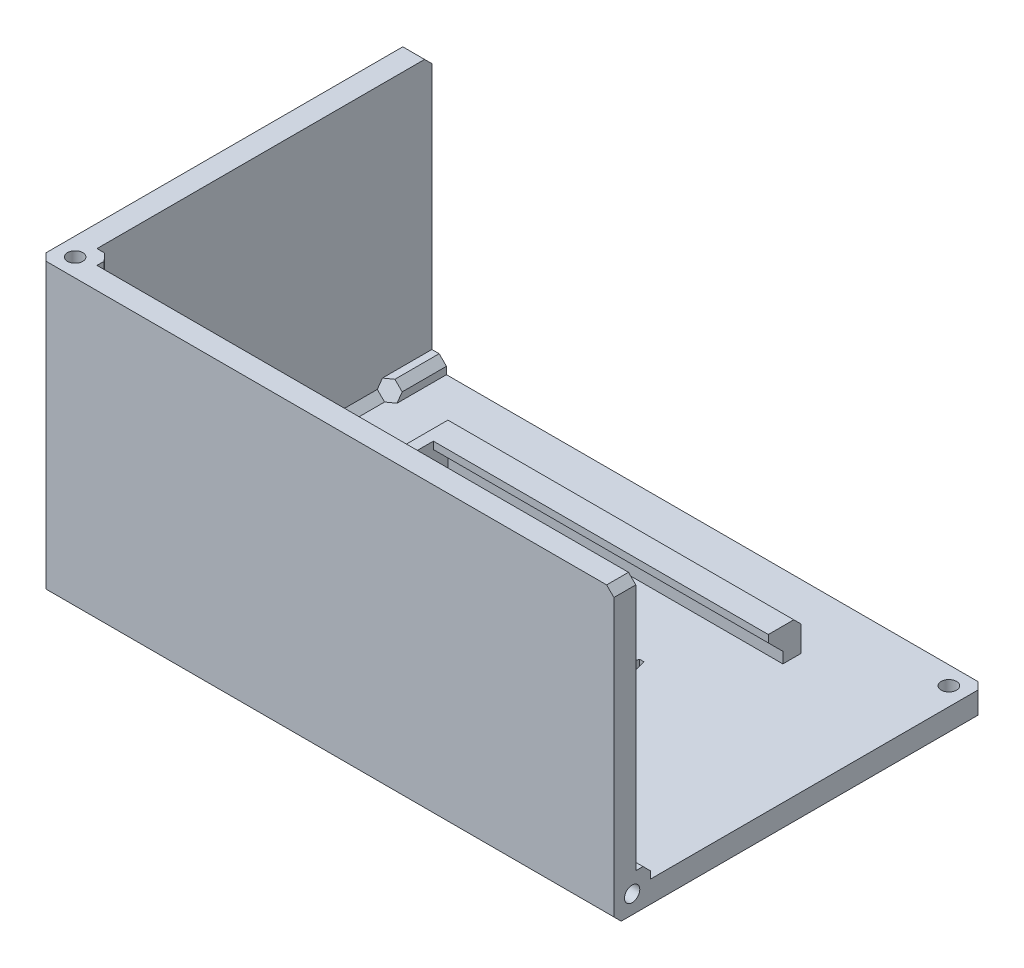
from build123d import *

# Parameters (mm, degrees)
SKETCH_1_W          = 79
SKETCH_1_H          = 51
EXTRUDE_1_DEPTH     = 3
EXTRUDE_2_DEPTH     = 37
SKETCH_3_W          = 5
SKETCH_3_H          = 5
EXTRUDE_3_DEPTH     = 6
SKETCH_4_R          = 1.05
CUT_EXTRUDE_1_DEPTH = 5
SKETCH_5_R          = 1.05
CUT_EXTRUDE_2_DEPTH = 5
SKETCH_6_W          = 5
SKETCH_6_H          = 5
EXTRUDE_4_DEPTH     = 6
SKETCH_7_R          = 1.05
CUT_EXTRUDE_3_DEPTH = 5
SKETCH_8_W          = 5
SKETCH_8_H          = 5
EXTRUDE_5_DEPTH     = 6
SKETCH_9_R          = 1.05
CUT_EXTRUDE_4_DEPTH = 5
CHAMFER_1_SIZE      = 1
CHAMFER_2_SIZE      = 1.5
CUT_EXTRUDE_START   = -3
CUT_EXTRUDE_5_DEPTH = 3
EXTRUDE_6_DEPTH     = 23
EXTRUDE_6_2_DEPTH   = 23
CHAMFER_3_SIZE      = 1
CHAMFER_4_SIZE      = 1
EXTRUDE_7_DEPTH     = 1.5


# Read off the part's stored shape, not the designer's step: 切除-拉伸5
with BuildPart() as part:
    # 草图1 → 凸台-拉伸1 (new body)
    with BuildSketch(Plane(origin=(0, 0, 0), x_dir=(1, 0, 0), z_dir=(0, 1, 0))):
        Rectangle(SKETCH_1_W, SKETCH_1_H)
    extrude(amount=EXTRUDE_1_DEPTH)

    # 草图2 → 凸台-拉伸2 (add)
    with BuildSketch(Plane(origin=(0, 3, 0), x_dir=(1, 0, 0), z_dir=(0, 1, 0))):
        Polygon((-39.5, 25.5), (-39.5, -25.5), (39.5, -25.5), (39.5, -22.5), (-36.5, -22.5), (-36.5, 25.5), align=None)
    extrude(amount=EXTRUDE_2_DEPTH)

    # 草图3 → 凸台-拉伸3 (add)
    with BuildSketch(Plane(origin=(39.5, 0, 0), x_dir=(0, 0, -1), z_dir=(1, 0, 0))):
        with Locations((-23, 2.5)):
            Rectangle(SKETCH_3_W, SKETCH_3_H)
    extrude(amount=-EXTRUDE_3_DEPTH)

    # 草图4 → 切除-拉伸1 (cut)
    with BuildSketch(Plane(origin=(39.5, 0, 0), x_dir=(0, 0, -1), z_dir=(1, 0, 0))):
        with Locations((-23, 2.5)):
            Circle(SKETCH_4_R)
    extrude(amount=-CUT_EXTRUDE_1_DEPTH, mode=Mode.SUBTRACT)

    # 草图5 → 切除-拉伸2 (cut)
    with BuildSketch(Plane(origin=(0, 0, 0), x_dir=(-1, 0, 0), z_dir=(0, -1, 0))):
        with Locations(Location((-37, 23, 0), (0, 0, 90))):
            Circle(SKETCH_5_R)
    extrude(amount=-CUT_EXTRUDE_2_DEPTH, mode=Mode.SUBTRACT)

    # 草图6 → 凸台-拉伸4 (add)
    with BuildSketch(Plane(origin=(0, 0, -25.5), x_dir=(-1, 0, 0), z_dir=(0, 0, -1))):
        with Locations((37, 2.5)):
            Rectangle(SKETCH_6_W, SKETCH_6_H)
    extrude(amount=-EXTRUDE_4_DEPTH)

    # 草图7 → 切除-拉伸3 (cut)
    with BuildSketch(Plane(origin=(0, 0, -25.5), x_dir=(-1, 0, 0), z_dir=(0, 0, -1))):
        with Locations((37, 2.5)):
            Circle(SKETCH_7_R)
    extrude(amount=-CUT_EXTRUDE_3_DEPTH, mode=Mode.SUBTRACT)

    # 草图8 → 凸台-拉伸5 (add)
    with BuildSketch(Plane(origin=(0, 40, 0), x_dir=(1, 0, 0), z_dir=(0, 1, 0))):
        with Locations((-37, -23)):
            Rectangle(SKETCH_8_W, SKETCH_8_H)
    extrude(amount=-EXTRUDE_5_DEPTH)

    # 草图9 → 切除-拉伸4 (cut)
    with BuildSketch(Plane(origin=(0, 40, 0), x_dir=(1, 0, 0), z_dir=(0, 1, 0))):
        with Locations(Location((-37, -23, 0), (0, 0, 270))):
            Circle(SKETCH_9_R)
    extrude(amount=-CUT_EXTRUDE_4_DEPTH, mode=Mode.SUBTRACT)

    # 倒角1
    chamfer_1_edges = [part.edges().sort_by_distance(p)[0] for p in [
        (-34.5, 37, 20.5),
        (-36.5, 3, 1.5),
        (-38, 40, -25.5),
        (39.5, 40, 24),
        (-1.5, 3, 22.5),
        (36.5, 5, 20.5),
        (0, 0, 25.5),
        (-39.5, 0, 0),
        (-34.5, 5, -22.5),
        (-39.5, 20, 25.5),
        (39.5, 1.5, -25.5),
        (-36.5, 18.5, 22.5),
    ]]
    chamfer(chamfer_1_edges, length=CHAMFER_1_SIZE)

    # 倒角2
    # the kernel refuses this chamfer: 1.5 mm, written as the material it adds along each edge
    with BuildSketch(Plane(origin=(-39.22768172, 6.72768172, -19.5), x_dir=(0.7068394360706735, 0.7068394360706735, -0.027495876610586743), z_dir=(0.7071067811865476, -0.7071067811865476, 0))) as chamfer_2_piece_1_section:
        Polygon((CHAMFER_2_SIZE * 0.999621916911, CHAMFER_2_SIZE * 0.0274958766106), (-CHAMFER_2_SIZE * 0.0274958766106, CHAMFER_2_SIZE * 0.999621916911), (0, 0), align=None)
    chamfer_2_piece_1 = extrude(amount=9.129262526, mode=Mode.PRIVATE)
    chamfer_2_piece_1 = split(chamfer_2_piece_1, bisect_by=Plane(origin=(-35.623861918, 5, -19.015969788), z_dir=(0, -1, 0)), keep=Keep.TOP, mode=Mode.PRIVATE)
    chamfer_2_piece_1 = split(chamfer_2_piece_1, bisect_by=Plane(origin=(-34.5, 3.876138082, -19.015969788), z_dir=(-1, 0, 0)), keep=Keep.TOP, mode=Mode.PRIVATE)
    chamfer_2_piece_1 = split(chamfer_2_piece_1, bisect_by=Plane(origin=(-35, 4.5, -19.015969788), z_dir=(-0.7071067811865476, -0.7071067811865476, 0)), keep=Keep.TOP, mode=Mode.PRIVATE)
    add(chamfer_2_piece_1)
    with BuildSketch(Plane(origin=(-32.77231828, 34, 25.22768172), x_dir=(-0.019442520806014937, -0.9996219169112968, 0.019442520806014937), z_dir=(-0.7071067811865476, 0, -0.7071067811865476))) as chamfer_2_piece_2_section:
        Polygon((CHAMFER_2_SIZE * 0.999621916911, -CHAMFER_2_SIZE * 0.0274958766106), (-CHAMFER_2_SIZE * 0.0274958766106, -CHAMFER_2_SIZE * 0.999621916911), (0, 0), align=None)
    chamfer_2_piece_2 = extrude(amount=9.129262526, mode=Mode.PRIVATE)
    chamfer_2_piece_2 = split(chamfer_2_piece_2, bisect_by=Plane(origin=(-34.5, 33.515969788, 21.623861918), z_dir=(-1, 0, 0)), keep=Keep.TOP, mode=Mode.PRIVATE)
    chamfer_2_piece_2 = split(chamfer_2_piece_2, bisect_by=Plane(origin=(-35, 33.515969788, 21), z_dir=(-0.7071067811865476, 0, 0.7071067811865476)), keep=Keep.TOP, mode=Mode.PRIVATE)
    chamfer_2_piece_2 = split(chamfer_2_piece_2, bisect_by=Plane(origin=(-35.623861918, 33.515969788, 20.5), z_dir=(0, 0, 1)), keep=Keep.TOP, mode=Mode.PRIVATE)
    add(chamfer_2_piece_2)
    with BuildSketch(Plane(origin=(33.5, 6.72768172, 25.22768172), x_dir=(0.027495876610586733, 0.7068394360706735, -0.7068394360706735), z_dir=(0, -0.7071067811865476, -0.7071067811865476))) as chamfer_2_piece_3_section:
        Polygon((CHAMFER_2_SIZE * 0.999621916911, -CHAMFER_2_SIZE * 0.0274958766106), (-CHAMFER_2_SIZE * 0.0274958766106, -CHAMFER_2_SIZE * 0.999621916911), (0, 0), align=None)
    chamfer_2_piece_3 = extrude(amount=9.129262526, mode=Mode.PRIVATE)
    chamfer_2_piece_3 = split(chamfer_2_piece_3, bisect_by=Plane(origin=(33.015969788, 5, 21.623861918), z_dir=(0, -1, 0)), keep=Keep.TOP, mode=Mode.PRIVATE)
    chamfer_2_piece_3 = split(chamfer_2_piece_3, bisect_by=Plane(origin=(33.015969788, 4.5, 21), z_dir=(0, -0.7071067811865476, 0.7071067811865476)), keep=Keep.TOP, mode=Mode.PRIVATE)
    chamfer_2_piece_3 = split(chamfer_2_piece_3, bisect_by=Plane(origin=(33.015969788, 3.876138082, 20.5), z_dir=(0, 0, 1)), keep=Keep.TOP, mode=Mode.PRIVATE)
    add(chamfer_2_piece_3)

    # 切除-拉伸5 outline → 切除-拉伸5 (cut)
    # profile 1 of 6: a face of its own
    with BuildSketch(Plane.XZ.offset(CUT_EXTRUDE_START)):
        with BuildLine():
            add(Edge.make_bspline(
                [(-15.48263371, -3.754815354), (-15.420128546, -3.756270608), (-15.309331072, -3.75885021), (-15.198540428, -3.761102728), (-15.150223737, -3.761203962)],
                knots=[0, 0, 0, 0, 0.37922531, 0.672219763, 0.672219763, 0.672219763, 0.672219763], degree=3))
            Line((-15.48263371, -3.754815354), (-16.788834434, -3.767600353))
            Line((-16.788834434, -3.767600353), (-17.153206904, -3.767600353))
            add(Edge.make_bspline(
                [(-17.470701044, -4.193766984), (-17.4945366, -4.167140367), (-17.536939279, -4.119772479), (-17.587669994, -4.053045156), (-17.622961086, -4.005137812), (-17.648748807, -3.957671202), (-17.627972402, -3.892415705), (-17.574871211, -3.841403188), (-17.501024479, -3.802184195), (-17.410113769, -3.780480784), (-17.291293362, -3.769689206), (-17.202245088, -3.76834216), (-17.153206904, -3.767600353)],
                knots=[0, 0, 0, 0, 0.124364607, 0.221240593, 0.290473734, 0.333628536, 0.401974035, 0.506869473, 0.585361363, 0.690256801, 0.829426855, 1, 1, 1, 1], degree=3))
            Line((-17.470701044, -4.193766984), (-16.882591093, -4.745652771))
            Line((-16.882591093, -4.745652771), (-16.339228638, -4.617802782))
            add(Edge.make_bspline(
                [(-15.11826124, -4.489952793), (-15.179395347, -4.492889571), (-15.321878045, -4.499734197), (-15.552292145, -4.527157062), (-15.807563179, -4.557246182), (-16.019075926, -4.574620737), (-16.17093028, -4.57831416), (-16.251903171, -4.592328053), (-16.309223401, -4.595941015), (-16.331642717, -4.612275692), (-16.339228638, -4.617802782)],
                knots=[0, 0, 0, 0, 0.14908402, 0.347463872, 0.565143028, 0.775125617, 0.865267116, 0.933313433, 0.977435571, 1, 1, 1, 1], degree=3))
            Line((-15.11826124, -4.489952793), (-14.383123801, -4.477167794))
            Line((-14.383123801, -4.477167794), (-13.481781377, -4.447336129))
            Line((-13.481781377, -4.447336129), (-13.117408907, -4.447336129))
            add(Edge.make_bspline(
                [(-12.844662263, -4.434551131), (-12.856733865, -4.435326958), (-12.88795805, -4.437333701), (-12.945563942, -4.438606114), (-13.024323046, -4.443900637), (-13.084016918, -4.446103741), (-13.117408907, -4.447336129)],
                knots=[0, 0, 0, 0, 0.132892113, 0.343736303, 0.63289448, 1, 1, 1, 1], degree=3))
            Line((-12.844662263, -4.434551131), (-12.48455146, -4.462251962))
            Line((-12.48455146, -4.462251962), (-12.152141487, -4.462251962))
            add(Edge.make_bspline(
                [(-11.943319838, -4.033954497), (-11.920286338, -4.054869257), (-11.878627775, -4.09269585), (-11.825351543, -4.150132093), (-11.797667666, -4.208577456), (-11.782095986, -4.276624466), (-11.798051338, -4.354827039), (-11.845364915, -4.418751501), (-11.906256775, -4.448977916), (-11.971642101, -4.462934812), (-12.055528497, -4.468633332), (-12.118062222, -4.464502926), (-12.152141487, -4.462251962)],
                knots=[0, 0, 0, 0, 0.122226479, 0.221059731, 0.304562511, 0.372874983, 0.492013136, 0.605167966, 0.671226803, 0.754356801, 0.8661308, 1, 1, 1, 1], degree=3))
            Line((-11.943319838, -4.033954497), (-12.584700618, -3.599264533))
            Line((-12.584700618, -3.599264533), (-12.995951417, -3.641881197))
            add(Edge.make_bspline(
                [(-14.253142979, -3.72498369), (-14.241069262, -3.724254777), (-14.200600395, -3.721811594), (-14.133804667, -3.718818201), (-14.035759628, -3.713546988), (-13.906496312, -3.704823325), (-13.727589359, -3.691553447), (-13.517302044, -3.678037381), (-13.313307866, -3.665774907), (-13.152307593, -3.651228234), (-13.053494324, -3.645257105), (-13.00802618, -3.642589595), (-12.995951417, -3.641881197)],
                knots=[0, 0, 0, 0, 0.028799673, 0.096531182, 0.159196007, 0.262579241, 0.404999879, 0.586342428, 0.764309979, 0.891553343, 0.971200327, 1, 1, 1, 1], degree=3))
            Line((-14.253142979, -3.72498369), (-14.253142979, 1.95368667))
            add(Edge.make_bspline(
                [(-14.12529299, 4.001417333), (-14.103307291, 3.949817758), (-14.064231049, 3.858107341), (-14.021296363, 3.734410267), (-13.995680596, 3.642650534), (-13.994293618, 3.558975286), (-14.026344726, 3.475775687), (-14.070473147, 3.380329601), (-14.116807093, 3.278603757), (-14.149093517, 3.169655273), (-14.169077049, 3.052077149), (-14.190383388, 2.915189154), (-14.205026758, 2.739107816), (-14.230753656, 2.516667548), (-14.250183009, 2.248052943), (-14.252121284, 2.055293279), (-14.253142979, 1.95368667)],
                knots=[0, 0, 0, 0, 0.079940062, 0.142081331, 0.186797154, 0.215157619, 0.259689521, 0.311830388, 0.365827104, 0.418700666, 0.473330159, 0.535784319, 0.616210576, 0.725159261, 0.855127185, 1, 1, 1, 1], degree=3))
            Line((-14.12529299, 4.001417333), (-14.327722139, 4.493639792))
            add(Edge.make_bspline(
                [(-14.623907948, 4.913413924), (-14.614532244, 4.91407852), (-14.584834338, 4.916183655), (-14.532334699, 4.87921806), (-14.460874643, 4.817129148), (-14.410955398, 4.705579953), (-14.359148195, 4.597706415), (-14.337029803, 4.524461895), (-14.327722139, 4.493639792)],
                knots=[0, 0, 0, 0, 0.051125076, 0.161940666, 0.334442272, 0.577379905, 0.822156799, 1, 1, 1, 1], degree=3))
            add(Edge.make_bspline(
                [(-15.060728745, 4.329565639), (-15.056800455, 4.40041657), (-15.048827177, 4.544223216), (-14.989949296, 4.715359407), (-14.91926111, 4.838465341), (-14.836660727, 4.900658324), (-14.73373167, 4.926930069), (-14.662292735, 4.918137988), (-14.623907948, 4.913413924)],
                knots=[0, 0, 0, 0, 0.250292928, 0.508021362, 0.633615737, 0.746809256, 0.863958321, 1, 1, 1, 1], degree=3))
            Line((-15.060728745, 4.329565639), (-15.150223737, 2.867814094))
            Line((-15.150223737, 2.867814094), (-15.150223737, -3.761203962))
        make_face()
    # profile 2 of 6: a face of its own
    with BuildSketch(Plane.XZ.offset(CUT_EXTRUDE_START)):
        with BuildLine():
            add(Edge.make_bspline(
                [(-8.103558491, 4.67476061), (-8.041461338, 4.669505959), (-7.911944528, 4.658546267), (-7.715013609, 4.60352904), (-7.507884986, 4.523610081), (-7.29029666, 4.418723222), (-7.072587453, 4.276791169), (-6.865733405, 4.089483475), (-6.672111059, 3.858998023), (-6.492777988, 3.58997156), (-6.32535958, 3.293622735), (-6.17766402, 2.97564047), (-6.044194131, 2.641630978), (-5.931969757, 2.294394866), (-5.836545261, 1.944521123), (-5.76254477, 1.60077644), (-5.70482392, 1.268387486), (-5.674613858, 0.946281813), (-5.659006507, 0.638408038), (-5.64845873, 0.34497151), (-5.653353031, 0.067012403), (-5.66323041, -0.113246613), (-5.668016194, -0.20058565)],
                knots=[0, 0, 0, 0, 0.031334491, 0.06535474, 0.102501622, 0.143147401, 0.186813498, 0.232930836, 0.28319018, 0.338070684, 0.395589235, 0.45449339, 0.514558707, 0.576678801, 0.638219114, 0.697172153, 0.753760562, 0.808055898, 0.860017348, 0.909058299, 0.955936957, 1, 1, 1, 1], degree=3))
            add(Edge.make_bspline(
                [(-11.110164074, 0.127562656), (-11.105887809, 0.213551505), (-11.097002003, 0.392230866), (-11.0691956, 0.668928746), (-11.024222694, 0.964005463), (-10.955894021, 1.386292929), (-10.824019358, 1.927410801), (-10.643014089, 2.462920573), (-10.465197802, 2.883443779), (-10.306054708, 3.186664878), (-10.128709571, 3.476969506), (-9.936077692, 3.752192597), (-9.725737528, 4.000631158), (-9.50017715, 4.212336923), (-9.258779885, 4.378323317), (-9.009841578, 4.50106052), (-8.762973023, 4.586491697), (-8.530194119, 4.647052706), (-8.311212831, 4.680849105), (-8.171125208, 4.676741689), (-8.103558491, 4.67476061)],
                knots=[0, 0, 0, 0, 0.043083178, 0.089524105, 0.139090764, 0.192444863, 0.303578138, 0.417336933, 0.47498038, 0.531899195, 0.588534262, 0.645145899, 0.699856338, 0.751171499, 0.799484671, 0.845903826, 0.889637579, 0.929985596, 0.966230826, 1, 1, 1, 1], degree=3))
            add(Edge.make_bspline(
                [(-8.546771788, -4.75843777), (-8.618174598, -4.749705375), (-8.76513644, -4.731732288), (-8.985867543, -4.665920384), (-9.214415884, -4.576432305), (-9.447401426, -4.45860015), (-9.673899032, -4.308644958), (-9.885782929, -4.126375434), (-10.072638656, -3.907720204), (-10.242086326, -3.663572474), (-10.389917627, -3.398755041), (-10.523926998, -3.124830645), (-10.64672324, -2.846372626), (-10.75064422, -2.558217375), (-10.843958112, -2.25996486), (-10.920358026, -1.94684998), (-10.992403973, -1.620550753), (-11.048792305, -1.281312832), (-11.092669241, -0.93382811), (-11.114027305, -0.581614003), (-11.125176521, -0.227519979), (-11.115178494, 0.008958844), (-11.110164074, 0.127562656)],
                knots=[0, 0, 0, 0, 0.035728167, 0.073536002, 0.114150379, 0.157763238, 0.203135392, 0.248971552, 0.296303111, 0.345800684, 0.396594084, 0.447001367, 0.497479185, 0.547891422, 0.599300463, 0.652859799, 0.708162251, 0.76549414, 0.823869367, 0.882298034, 0.940967645, 1, 1, 1, 1], degree=3))
            add(Edge.make_bspline(
                [(-5.668016194, -0.20058565), (-5.679560027, -0.339220651), (-5.703358919, -0.625032078), (-5.764412461, -1.062838839), (-5.846102501, -1.522705486), (-5.946732252, -1.995420454), (-6.074869473, -2.463631755), (-6.249696975, -2.903620786), (-6.458886584, -3.31167186), (-6.709643311, -3.673339634), (-6.969109927, -3.988791014), (-7.223650903, -4.247919848), (-7.466475297, -4.448980292), (-7.706720437, -4.581236117), (-7.934068957, -4.665715486), (-8.147198996, -4.724574345), (-8.350252477, -4.759694644), (-8.48272495, -4.758847393), (-8.546771788, -4.75843777)],
                knots=[0, 0, 0, 0, 0.070798454, 0.145958862, 0.224892982, 0.308497601, 0.391926937, 0.471616661, 0.549073153, 0.624781961, 0.695142443, 0.756752631, 0.809487994, 0.854962053, 0.89558416, 0.932683052, 0.967454086, 1, 1, 1, 1], degree=3))
        make_face()
        with BuildLine():
            add(Edge.make_bspline(
                [(-6.575751119, -0.153707321), (-6.570868248, -0.084129651), (-6.56061339, 0.061995266), (-6.557413696, 0.292367535), (-6.562110677, 0.544605463), (-6.574010519, 0.816928046), (-6.599339755, 1.104261466), (-6.639404865, 1.400280603), (-6.697490454, 1.701776081), (-6.771801412, 2.00437608), (-6.856566369, 2.301779416), (-6.957543049, 2.583015202), (-7.066656689, 2.846131926), (-7.190322027, 3.084008664), (-7.314641758, 3.296140681), (-7.44440261, 3.472729502), (-7.575915592, 3.611928276), (-7.710675613, 3.71154057), (-7.83861863, 3.78000299), (-7.952964516, 3.832257625), (-8.05441565, 3.869971995), (-8.120360367, 3.876831376), (-8.150436821, 3.879959843)],
                knots=[0, 0, 0, 0, 0.045157309, 0.094838015, 0.149117275, 0.208512086, 0.271305268, 0.335829695, 0.401857755, 0.47001556, 0.537551362, 0.601995419, 0.663414278, 0.721832335, 0.775468658, 0.822473626, 0.863456253, 0.898963146, 0.930457279, 0.957216217, 0.980486921, 1, 1, 1, 1], degree=3))
            add(Edge.make_bspline(
                [(-8.493500959, -3.965767836), (-8.462852593, -3.963721732), (-8.396564001, -3.959296263), (-8.292282963, -3.934217552), (-8.176763764, -3.894309241), (-8.043497878, -3.842175263), (-7.894819769, -3.747781676), (-7.737286451, -3.595607608), (-7.561424269, -3.391268583), (-7.369813483, -3.137889464), (-7.181593529, -2.836168254), (-7.020119374, -2.488372322), (-6.888384518, -2.102335416), (-6.789821214, -1.687987037), (-6.709913118, -1.270700612), (-6.645368237, -0.872125774), (-6.598788147, -0.503304874), (-6.583199408, -0.266738549), (-6.575751119, -0.153707321)],
                knots=[0, 0, 0, 0, 0.02013971, 0.043559681, 0.0701049, 0.100417777, 0.137294984, 0.184821717, 0.243652345, 0.314258093, 0.393203917, 0.476653558, 0.565436976, 0.660560202, 0.756045125, 0.844368049, 0.92563916, 1, 1, 1, 1], degree=3))
            add(Edge.make_bspline(
                [(-10.151289154, -1.161591403), (-10.137446538, -1.260504857), (-10.110356175, -1.454081082), (-10.052858954, -1.733319246), (-9.995530836, -1.997383456), (-9.901227137, -2.322134532), (-9.758879337, -2.708854892), (-9.58914083, -3.076617203), (-9.432469493, -3.346373336), (-9.303087167, -3.517505655), (-9.165620845, -3.658880678), (-9.019672457, -3.769381021), (-8.872690999, -3.84625546), (-8.738623408, -3.911489933), (-8.612751004, -3.951250591), (-8.531348196, -3.961160394), (-8.493500959, -3.965767836)],
                knots=[0, 0, 0, 0, 0.086217949, 0.168730788, 0.246098236, 0.319475708, 0.460533721, 0.601553063, 0.668659718, 0.729501491, 0.786314944, 0.838446558, 0.886758348, 0.929294165, 0.967126189, 1, 1, 1, 1], degree=3))
            add(Edge.make_bspline(
                [(-8.150436821, 3.879959843), (-8.190974644, 3.882991205), (-8.275337721, 3.889299758), (-8.405899898, 3.866490177), (-8.543853677, 3.82777926), (-8.689096496, 3.768438607), (-8.840668057, 3.679616503), (-8.988141793, 3.547889195), (-9.140381729, 3.383044639), (-9.287047616, 3.182444188), (-9.430160603, 2.959734277), (-9.562149216, 2.720376636), (-9.682201433, 2.468949211), (-9.820031781, 2.115070434), (-9.963925994, 1.654564271), (-10.088611958, 1.093018842), (-10.168879324, 0.544943569), (-10.210394331, 0.102742292), (-10.220237451, -0.247501619), (-10.209728527, -0.529713197), (-10.189552513, -0.837631843), (-10.164365228, -1.050881858), (-10.151289154, -1.161591403)],
                knots=[0, 0, 0, 0, 0.020541034, 0.042747852, 0.06669156, 0.093176477, 0.122082653, 0.155286602, 0.193007636, 0.235721178, 0.281076877, 0.32718137, 0.374221639, 0.422240241, 0.519629983, 0.618538811, 0.713580882, 0.800346511, 0.843577702, 0.89113898, 0.943484393, 1, 1, 1, 1], degree=3))
        make_face(mode=Mode.SUBTRACT)
    # profile 3 of 6: a face of its own
    with BuildSketch(Plane.XZ.offset(CUT_EXTRUDE_START)):
        with BuildLine():
            add(Edge.make_bspline(
                [(-0.07457916, -3.55664787), (-0.046774635, -3.574956566), (0.012475036, -3.61397123), (0.088850965, -3.668343226), (0.157053488, -3.723310378), (0.220052109, -3.776795222), (0.289096686, -3.845710218), (0.36451225, -3.92117868), (0.431575547, -3.999663209), (0.483266394, -4.073239645), (0.5025895, -4.145360801), (0.492991069, -4.225608075), (0.449218779, -4.304269687), (0.376018527, -4.379177834), (0.262375331, -4.41055043), (0.157028858, -4.391271137), (0.069066499, -4.36932015), (0.012090338, -4.357029405), (-0.029649386, -4.347691943), (-0.063764025, -4.34211412), (-0.105811882, -4.340122473), (-0.171224423, -4.340354055), (-0.267734135, -4.346223945), (-0.385729427, -4.348699538), (-0.505125445, -4.354677467), (-0.60612064, -4.362351661), (-0.680235686, -4.372266522), (-0.719554658, -4.381773994), (-0.735137439, -4.385541968)],
                knots=[0, 0, 0, 0, 0.044876518, 0.095629001, 0.126281512, 0.16293971, 0.206949964, 0.257729532, 0.306642541, 0.346222483, 0.377802953, 0.404764246, 0.453149673, 0.49649887, 0.542534919, 0.605127288, 0.638568656, 0.665049685, 0.683639488, 0.69623243, 0.711581098, 0.740303806, 0.784386899, 0.84186422, 0.899381398, 0.945497025, 0.978399539, 1, 1, 1, 1], degree=3))
            Line((-0.07457916, -3.55664787), (-0.07457916, 3.694577359))
            Line((-0.07457916, 3.694577359), (0.294054975, 3.694577359))
            add(Edge.make_bspline(
                [(-0.385680801, 4.683283943), (-0.354662421, 4.687022081), (-0.291635465, 4.694617689), (-0.216348414, 4.655201561), (-0.15066928, 4.617049262), (-0.086972715, 4.575440549), (-0.008363956, 4.52729086), (0.110674812, 4.453052161), (0.255486027, 4.354307349), (0.393671057, 4.219252917), (0.493387636, 4.092868765), (0.543574747, 3.97299097), (0.548182768, 3.872831531), (0.539330615, 3.798094695), (0.501904146, 3.750704245), (0.45001219, 3.726906894), (0.379897062, 3.705989198), (0.324806378, 3.698665447), (0.294054975, 3.694577359)],
                knots=[0, 0, 0, 0, 0.055199119, 0.112160353, 0.147818185, 0.193390787, 0.249301417, 0.314462416, 0.446940302, 0.564925092, 0.662206331, 0.736563346, 0.794442444, 0.843023772, 0.867676186, 0.899836932, 0.94408937, 1, 1, 1, 1], degree=3))
            add(Edge.make_bspline(
                [(-1.299808225, 4.461677295), (-1.245840585, 4.468195325), (-1.147173638, 4.480111989), (-1.013591208, 4.49452168), (-0.908588064, 4.506572507), (-0.805122364, 4.512167466), (-0.690333663, 4.537679589), (-0.568177468, 4.592998313), (-0.470343472, 4.652842726), (-0.407941619, 4.675279868), (-0.385680801, 4.683283943)],
                knots=[0, 0, 0, 0, 0.1713943, 0.313353561, 0.423660838, 0.504563725, 0.63986603, 0.791312573, 0.925554251, 1, 1, 1, 1], degree=3))
            Line((-1.299808225, 4.461677295), (-2.311953974, 4.348743138))
            add(Edge.make_bspline(
                [(-4.562113786, 1.862060845), (-4.558177522, 1.947371904), (-4.55051649, 2.113410187), (-4.521978558, 2.355977831), (-4.482525394, 2.586192919), (-4.427594326, 2.804686277), (-4.35524373, 3.009572609), (-4.26579924, 3.202105205), (-4.154127177, 3.378421083), (-4.025294772, 3.543111168), (-3.874750238, 3.692053319), (-3.705310698, 3.829811883), (-3.514994353, 3.952028874), (-3.307642718, 4.064113986), (-3.081614286, 4.158558728), (-2.839883221, 4.240460982), (-2.581593255, 4.303881983), (-2.403091993, 4.333580077), (-2.311953974, 4.348743138)],
                knots=[0, 0, 0, 0, 0.068690246, 0.133689707, 0.196353795, 0.256505239, 0.314703155, 0.370940653, 0.426910408, 0.482243505, 0.5388139, 0.59691354, 0.657618889, 0.720511849, 0.786317671, 0.854444639, 0.925683285, 1, 1, 1, 1], degree=3))
            add(Edge.make_bspline(
                [(-3.385893885, -0.432846464), (-3.445730996, -0.406102526), (-3.569692372, -0.350698525), (-3.71572979, -0.250983928), (-3.835160617, -0.149339308), (-3.931058591, -0.045838558), (-4.037107812, 0.075885409), (-4.145373061, 0.218789194), (-4.252610142, 0.374837313), (-4.339887665, 0.546738789), (-4.418682588, 0.723486891), (-4.478837527, 0.912858383), (-4.523727517, 1.118206224), (-4.553335517, 1.344837827), (-4.564660835, 1.59559137), (-4.562989612, 1.770432912), (-4.562113786, 1.862060845)],
                knots=[0, 0, 0, 0, 0.071557487, 0.148241856, 0.192299355, 0.242835515, 0.302309056, 0.368793424, 0.438799946, 0.508974282, 0.579238813, 0.650220785, 0.725783936, 0.808824048, 0.899811811, 1, 1, 1, 1], degree=3))
            Line((-3.385893885, -0.432846464), (-3.692733859, -0.643798946))
            add(Edge.make_bspline(
                [(-4.19987215, -2.263232145), (-4.191525425, -2.170088112), (-4.174265529, -1.977478871), (-4.129984766, -1.681588785), (-4.060937463, -1.372794241), (-3.976617217, -1.117007068), (-3.900850284, -0.922513146), (-3.838006131, -0.802176986), (-3.769995939, -0.709065092), (-3.717000059, -0.664297506), (-3.692733859, -0.643798946)],
                knots=[0, 0, 0, 0, 0.162140095, 0.335283754, 0.518441291, 0.710074423, 0.80178975, 0.880036575, 0.945070135, 1, 1, 1, 1], degree=3))
            add(Edge.make_bspline(
                [(-2.52503729, -4.703036108), (-2.60062967, -4.69729416), (-2.748315592, -4.686076033), (-2.961771335, -4.63436961), (-3.163285591, -4.563536753), (-3.348864302, -4.464346648), (-3.51642764, -4.346144468), (-3.662844286, -4.210322595), (-3.788201313, -4.06072601), (-3.88889441, -3.892910617), (-3.972114234, -3.710272569), (-4.039272457, -3.51135948), (-4.094925181, -3.297038993), (-4.135986844, -3.071786661), (-4.163350742, -2.847380547), (-4.186417111, -2.635820805), (-4.196325448, -2.443028781), (-4.198737136, -2.320770594), (-4.19987215, -2.263232145)],
                knots=[0, 0, 0, 0, 0.06818987, 0.133223532, 0.197184388, 0.260154992, 0.322116219, 0.381430662, 0.439598538, 0.497321272, 0.557161437, 0.620093019, 0.686206851, 0.756487169, 0.826170739, 0.889839673, 0.948155175, 1, 1, 1, 1], degree=3))
            add(Edge.make_bspline(
                [(-1.623694865, -4.573055286), (-1.650692195, -4.57799031), (-1.711811576, -4.589162736), (-1.813191977, -4.608669601), (-1.934725848, -4.62957415), (-2.068845452, -4.652430801), (-2.203919555, -4.672192457), (-2.326468548, -4.690956167), (-2.431900129, -4.698941191), (-2.495910749, -4.701755516), (-2.52503729, -4.703036108)],
                knots=[0, 0, 0, 0, 0.090327225, 0.204492217, 0.339776186, 0.496192595, 0.652241725, 0.789112009, 0.904040337, 1, 1, 1, 1], degree=3))
            Line((-1.623694865, -4.573055286), (-0.735137439, -4.385541968))
        make_face()
        with BuildLine():
            add(Edge.make_bspline(
                [(-2.020029832, -0.790826434), (-2.088190928, -0.798084286), (-2.21390546, -0.811470476), (-2.388627033, -0.827841524), (-2.532205785, -0.853699124), (-2.652457448, -0.872109011), (-2.756701244, -0.90480854), (-2.848735473, -0.962376788), (-2.934995142, -1.040497668), (-3.03836939, -1.173270948), (-3.148544785, -1.361966658), (-3.251267183, -1.608571303), (-3.311176667, -1.878901506), (-3.327754569, -2.165712094), (-3.323191389, -2.459966951), (-3.323798401, -2.657432257), (-3.324099723, -2.755454604)],
                knots=[0, 0, 0, 0, 0.074166798, 0.136791291, 0.189722631, 0.231922438, 0.268371474, 0.306983756, 0.348335523, 0.393697939, 0.488449855, 0.583912625, 0.681594833, 0.786381145, 0.893958986, 1, 1, 1, 1], degree=3))
            Line((-2.020029832, -0.790826434), (-0.935435755, -0.667238111))
            Line((-0.935435755, -0.667238111), (-0.935435755, -3.631227031))
            Line((-0.935435755, -3.631227031), (-1.79629235, -3.812347849))
            add(Edge.make_bspline(
                [(-3.324099723, -2.755454604), (-3.318571155, -2.813107245), (-3.307945816, -2.9239097), (-3.279144739, -3.080003776), (-3.248859045, -3.220327646), (-3.196153001, -3.379013326), (-3.108042816, -3.551438675), (-2.96496761, -3.719057023), (-2.791051114, -3.835112911), (-2.601482559, -3.8886282), (-2.422924846, -3.900776971), (-2.280007316, -3.894114687), (-2.164864691, -3.875172022), (-2.059744344, -3.858200158), (-1.934711549, -3.836977756), (-1.844578724, -3.820939785), (-1.79629235, -3.812347849)],
                knots=[0, 0, 0, 0, 0.076833594, 0.147666276, 0.210556294, 0.267200476, 0.369245398, 0.46547172, 0.556729838, 0.642334427, 0.723680026, 0.793546203, 0.831678534, 0.878485466, 0.934901672, 1, 1, 1, 1], degree=3))
        make_face(mode=Mode.SUBTRACT)
        with BuildLine():
            add(Edge.make_bspline(
                [(-0.935435755, 3.711624024), (-1.003618409, 3.715021546), (-1.133626687, 3.72149982), (-1.297882968, 3.712232119), (-1.438354239, 3.700101784), (-1.572061615, 3.688051004), (-1.735758799, 3.666909505), (-1.923137103, 3.648927924), (-2.117538247, 3.620739565), (-2.305111244, 3.593275676), (-2.476668438, 3.555280361), (-2.636042109, 3.517060112), (-2.78536891, 3.463413878), (-2.925902084, 3.387135451), (-3.060024076, 3.288352607), (-3.185328023, 3.170570874), (-3.297397362, 3.041513885), (-3.399885648, 2.912840918), (-3.47947548, 2.779559726), (-3.568320985, 2.608502983), (-3.641220404, 2.387695445), (-3.687643674, 2.121025047), (-3.698237157, 1.857790904), (-3.691699322, 1.685173656), (-3.688472193, 1.599968367)],
                knots=[0, 0, 0, 0, 0.050210329, 0.095739282, 0.120919174, 0.15400265, 0.194529898, 0.242388256, 0.29251415, 0.339096364, 0.381851714, 0.421791407, 0.459666017, 0.49825898, 0.539038318, 0.581943615, 0.624532452, 0.664789064, 0.702804117, 0.738574664, 0.806520566, 0.87287106, 0.937248112, 1, 1, 1, 1], degree=3))
            Line((-0.935435755, 3.711624024), (-0.935435755, 0.061506828))
            Line((-0.935435755, 0.061506828), (-1.568293203, 0.0018435))
            add(Edge.make_bspline(
                [(-3.688472193, 1.599968367), (-3.675191741, 1.488782432), (-3.649562431, 1.274210001), (-3.574509277, 0.96972876), (-3.460682366, 0.69557118), (-3.293468007, 0.462467284), (-3.08500363, 0.271594874), (-2.847078718, 0.128537111), (-2.602552916, 0.033476257), (-2.393648606, -0.01653551), (-2.210448077, -0.025442731), (-2.034167714, -0.024651142), (-1.815288055, -0.015504224), (-1.655627445, -0.004290435), (-1.568293203, 0.0018435)],
                knots=[0, 0, 0, 0, 0.109079275, 0.210506891, 0.304784363, 0.396620014, 0.487766648, 0.578486265, 0.665530218, 0.742806833, 0.786514288, 0.84398141, 0.914657939, 1, 1, 1, 1], degree=3))
        make_face(mode=Mode.SUBTRACT)
    # profile 4 of 6: a face of its own
    with BuildSketch(Plane.XZ.offset(CUT_EXTRUDE_START)):
        with BuildLine():
            add(Edge.make_bspline(
                [(3.412437357, -0.071227883), (3.38922616, -0.045592621), (3.321942972, 0.029329424), (3.209528722, 0.1623042), (3.092080797, 0.347978995), (3.013821748, 0.577285212), (2.958604961, 0.840251802), (2.916395845, 1.145016664), (2.888322124, 1.499301279), (2.886257176, 1.753325371), (2.885148093, 1.889761676)],
                knots=[0.031631926, 0.031631926, 0.031631926, 0.031631926, 0.07970973, 0.171628686, 0.273581544, 0.382918263, 0.506303721, 0.646929676, 0.810365978, 1, 1, 1, 1], degree=3))
            Line((3.412437357, -0.071227883), (3.398678883, -0.072735661))
            add(Edge.make_bspline(
                [(2.346047304, -2.182260485), (2.347533955, -2.089909614), (2.35030357, -1.917860888), (2.363531581, -1.677928794), (2.389881766, -1.475387178), (2.440625664, -1.256758692), (2.530910391, -1.020527247), (2.654700279, -0.758276458), (2.805048419, -0.523966736), (2.947246058, -0.350136929), (3.071459453, -0.230554171), (3.174411652, -0.16111994), (3.28259743, -0.104845881), (3.359822395, -0.083484065), (3.398678883, -0.072735661)],
                knots=[0, 0, 0, 0, 0.110253546, 0.205401227, 0.286700349, 0.353747113, 0.472837069, 0.587739462, 0.699460119, 0.804220299, 0.855212981, 0.904601447, 0.951999294, 1, 1, 1, 1], degree=3))
            add(Edge.make_bspline(
                [(5.35478372, -4.517653624), (5.22053204, -4.523859995), (4.971906323, -4.535353807), (4.628948661, -4.553857242), (4.346107055, -4.564350473), (4.114142855, -4.579751538), (3.911241901, -4.577350772), (3.718103522, -4.548705009), (3.525185055, -4.496999041), (3.335990358, -4.42309993), (3.157288952, -4.331089265), (2.996820467, -4.224136342), (2.855573892, -4.106490617), (2.735589987, -3.971953694), (2.636966295, -3.816259628), (2.55088034, -3.641060117), (2.484015893, -3.440799689), (2.431303006, -3.219652249), (2.394824084, -2.979236558), (2.367356529, -2.724705794), (2.349970088, -2.457373729), (2.347374407, -2.275333065), (2.346047304, -2.182260485)],
                knots=[0, 0, 0, 0, 0.086605604, 0.160388163, 0.221325781, 0.268982817, 0.310187072, 0.35180868, 0.394442291, 0.438641732, 0.482450778, 0.523708385, 0.562681162, 0.600616077, 0.639338084, 0.681097882, 0.726114509, 0.775072585, 0.827446126, 0.882692938, 0.940024, 1, 1, 1, 1], degree=3))
            Line((5.35478372, -4.517653624), (6.008949499, -4.479298627))
            Line((6.008949499, -4.479298627), (6.364798636, -4.517653624))
            Line((6.364798636, -4.517653624), (6.72490944, -4.547485288))
            add(Edge.make_bspline(
                [(7.074366077, -4.072309494), (7.096135631, -4.109334896), (7.135914589, -4.176990479), (7.17470368, -4.279147867), (7.187116304, -4.37068229), (7.174783807, -4.453100798), (7.120923452, -4.523127489), (7.019284427, -4.551378882), (6.885765425, -4.562757046), (6.783228172, -4.553022101), (6.72490944, -4.547485288)],
                knots=[0, 0, 0, 0, 0.145803235, 0.266422575, 0.368499105, 0.457006971, 0.542944004, 0.6514107, 0.801737562, 1, 1, 1, 1], degree=3))
            Line((7.074366077, -4.072309494), (6.897506925, -3.861357012))
            add(Edge.make_bspline(
                [(6.803750266, -3.509769541), (6.805041939, -3.545351599), (6.807486846, -3.612702087), (6.823848153, -3.707774393), (6.853627174, -3.790862295), (6.883183525, -3.83834585), (6.897506925, -3.861357012)],
                knots=[0, 0, 0, 0, 0.288890762, 0.546818661, 0.780382307, 1, 1, 1, 1], degree=3))
            Line((6.803750266, -3.509769541), (6.803750266, 2.011219166))
            add(Edge.make_bspline(
                [(6.933731089, 4.041903163), (6.955255103, 3.989445011), (6.9931534, 3.897079589), (7.040129449, 3.774944734), (7.065474696, 3.686004532), (7.074507004, 3.608819258), (7.048328167, 3.5323363), (7.004056467, 3.445445339), (6.951483349, 3.341655785), (6.911281187, 3.220757738), (6.879283641, 3.097901634), (6.855582447, 2.994977907), (6.844005382, 2.89717258), (6.840421312, 2.78601167), (6.826966004, 2.635026424), (6.820486612, 2.458723102), (6.816243585, 2.287446498), (6.807412114, 2.15192865), (6.807068708, 2.065152647), (6.804536721, 2.024001144), (6.803750266, 2.011219166)],
                knots=[0, 0, 0, 0, 0.081252925, 0.14306567, 0.187245142, 0.213780155, 0.252781155, 0.300117364, 0.354278546, 0.418964394, 0.482152212, 0.536236868, 0.570062505, 0.623064199, 0.695490689, 0.787162512, 0.875743832, 0.940939903, 0.981655473, 1, 1, 1, 1], degree=3))
            Line((6.933731089, 4.041903163), (6.735563605, 4.527733123))
            add(Edge.make_bspline(
                [(6.432985297, 4.95816142), (6.442357311, 4.958823278), (6.472043529, 4.960919739), (6.525624436, 4.923494562), (6.59782294, 4.857885495), (6.659106151, 4.747458642), (6.718333379, 4.636962011), (6.730561703, 4.559442063), (6.735563605, 4.527733123)],
                knots=[0, 0, 0, 0, 0.049724128, 0.157503111, 0.330684316, 0.580039437, 0.828218348, 1, 1, 1, 1], degree=3))
            add(Edge.make_bspline(
                [(5.925847006, 3.304634891), (5.930081749, 3.366430599), (5.938212191, 3.485074508), (5.950227111, 3.654184838), (5.964758901, 3.805945022), (5.972076792, 3.941086886), (5.980364033, 4.059020262), (5.989563779, 4.160478333), (5.996019955, 4.244292145), (6.003102136, 4.372727944), (6.027764267, 4.548959986), (6.066174939, 4.736716372), (6.125796658, 4.871866436), (6.206427128, 4.940713208), (6.314196182, 4.970277009), (6.391021063, 4.962441454), (6.432985297, 4.95816142)],
                knots=[0, 0, 0, 0, 0.097043164, 0.186316827, 0.265606919, 0.335854197, 0.39832951, 0.450819966, 0.495456797, 0.530025175, 0.65231628, 0.773769122, 0.830006593, 0.87973498, 0.934307358, 1, 1, 1, 1], degree=3))
            Line((5.925847006, 3.304634891), (5.925847006, 0.140347655))
            Line((5.925847006, 0.140347655), (5.333475389, 0.099861825))
            add(Edge.make_bspline(
                [(3.763051353, 1.806659183), (3.769863473, 1.7178484), (3.784426916, 1.527982279), (3.80792745, 1.28788276), (3.831108894, 1.091565163), (3.855464493, 0.9567764), (3.879629809, 0.837524582), (3.918673908, 0.702442848), (3.983597893, 0.5522832), (4.086355887, 0.394156546), (4.215637811, 0.265817368), (4.375238087, 0.177769162), (4.565429677, 0.129952957), (4.789680766, 0.098624939), (5.050824692, 0.090487046), (5.236198412, 0.096635404), (5.333475389, 0.099861825)],
                knots=[0, 0, 0, 0, 0.09567924, 0.204550007, 0.259156235, 0.307952215, 0.351649989, 0.3897998, 0.458828824, 0.52654662, 0.591297989, 0.652437748, 0.71982807, 0.800756041, 0.895444458, 1, 1, 1, 1], degree=3))
            Line((3.763051353, 1.806659183), (3.746004688, 2.494918292))
            Line((3.746004688, 2.494918292), (3.728958023, 3.174654069))
            add(Edge.make_bspline(
                [(2.872363094, 4.561826453), (2.920047229, 4.557037808), (3.011959829, 4.547807551), (3.142246474, 4.520286563), (3.25593126, 4.471321976), (3.356350522, 4.409331729), (3.442006227, 4.328906739), (3.516902824, 4.232273333), (3.577173868, 4.117195343), (3.627171612, 3.982480907), (3.667040253, 3.824606097), (3.699092111, 3.63664), (3.718625986, 3.41648744), (3.725375832, 3.25849943), (3.728958023, 3.174654069)],
                knots=[0, 0, 0, 0, 0.078112405, 0.150564004, 0.215926758, 0.27887692, 0.341954683, 0.406325783, 0.477282218, 0.552750706, 0.640073439, 0.742273555, 0.863222741, 1, 1, 1, 1], degree=3))
            add(Edge.make_bspline(
                [(1.425527381, 3.055327412), (1.425956342, 3.14840556), (1.42675272, 3.321207956), (1.442056539, 3.560086653), (1.463082184, 3.758438277), (1.496927976, 3.921206893), (1.54670109, 4.058560387), (1.620975743, 4.177816344), (1.718602687, 4.283055781), (1.836151424, 4.37333033), (1.966037331, 4.449988331), (2.106225979, 4.504153221), (2.250060313, 4.545157149), (2.397635991, 4.559036499), (2.538502092, 4.563253885), (2.66564038, 4.569696701), (2.77510983, 4.566682625), (2.841828254, 4.563351157), (2.872363094, 4.561826453)],
                knots=[0, 0, 0, 0, 0.110889115, 0.205868995, 0.285131321, 0.348383953, 0.403561385, 0.458289072, 0.514597411, 0.573686838, 0.634367258, 0.693620124, 0.752338623, 0.811971107, 0.869581146, 0.92039234, 0.963566179, 1, 1, 1, 1], degree=3))
            Line((1.425527381, 3.055327412), (1.425527381, 1.930247506))
            Line((1.425527381, 1.930247506), (2.047730663, 1.930247506))
            Line((2.047730663, 1.930247506), (2.147879821, 2.859290762))
            add(Edge.make_bspline(
                [(2.606008949, 3.767025686), (2.569135739, 3.769649543), (2.503030984, 3.774353484), (2.408292758, 3.754826772), (2.333081681, 3.693373173), (2.277211842, 3.596799395), (2.231032065, 3.467524167), (2.20139298, 3.301926547), (2.178491731, 3.095741109), (2.158819109, 2.943787238), (2.147879821, 2.859290762)],
                knots=[0, 0, 0, 0, 0.096191741, 0.172448547, 0.244957408, 0.341415485, 0.459609917, 0.601069405, 0.778168009, 1, 1, 1, 1], degree=3))
            add(Edge.make_bspline(
                [(2.83613893, 3.095813242), (2.83441434, 3.176041632), (2.831283171, 3.321704417), (2.822838311, 3.494165866), (2.807845417, 3.60471402), (2.805592052, 3.666000694), (2.792100505, 3.705313658), (2.786279005, 3.736813207), (2.759619943, 3.750573036), (2.724256161, 3.761067605), (2.67065386, 3.766007675), (2.629408461, 3.766657197), (2.606008949, 3.767025686)],
                knots=[0, 0, 0, 0, 0.291537421, 0.529315782, 0.625297331, 0.697924557, 0.748595212, 0.778782434, 0.806679325, 0.84991239, 0.914851674, 1, 1, 1, 1], degree=3))
            Line((2.83613893, 3.095813242), (2.885148093, 1.889761676))
        make_face()
        with BuildLine():
            add(Edge.make_bspline(
                [(4.502450458, -0.692808109), (4.438442773, -0.695358285), (4.317184875, -0.700189409), (4.146497946, -0.722326169), (3.996765227, -0.749896481), (3.835302418, -0.802428389), (3.671835025, -0.882573268), (3.537543571, -0.986920761), (3.460824191, -1.089221486), (3.409639018, -1.179221377), (3.365963036, -1.286215385), (3.326065161, -1.412004842), (3.294028953, -1.565263879), (3.27199691, -1.753442649), (3.258573886, -1.980368179), (3.249497299, -2.234729796), (3.252635777, -2.494481923), (3.271655352, -2.736438825), (3.302471779, -2.949804741), (3.34050418, -3.078942561), (3.358193053, -3.139004572)],
                knots=[0, 0, 0, 0, 0.059155124, 0.112065075, 0.158913543, 0.199591522, 0.268562048, 0.32637319, 0.354462652, 0.386208622, 0.421798639, 0.461026732, 0.508008312, 0.566209258, 0.635925098, 0.718000486, 0.801356752, 0.875749781, 0.942211213, 1, 1, 1, 1], degree=3))
            Line((4.502450458, -0.692808109), (5.942893671, -0.63953728))
            Line((5.942893671, -0.63953728), (5.925847006, -3.707937024))
            Line((5.925847006, -3.707937024), (5.463456211, -3.72498369))
            add(Edge.make_bspline(
                [(4.206264649, -3.754815354), (4.22615393, -3.754930758), (4.27517546, -3.755215197), (4.362512603, -3.751973084), (4.47832875, -3.751074172), (4.621732623, -3.744907285), (4.793013661, -3.745408245), (4.991805024, -3.736752068), (5.218405274, -3.731197925), (5.378933367, -3.727127101), (5.463456211, -3.72498369)],
                knots=[0, 0, 0, 0, 0.047442724, 0.116933087, 0.208445456, 0.323713323, 0.459274552, 0.616934135, 0.798304361, 1, 1, 1, 1], degree=3))
            add(Edge.make_bspline(
                [(3.358193053, -3.139004572), (3.376826509, -3.191351281), (3.411665937, -3.289225208), (3.479759645, -3.420700808), (3.56127145, -3.524309334), (3.654748957, -3.605803233), (3.76585826, -3.664470633), (3.895747004, -3.704228675), (4.043329296, -3.740804854), (4.14990182, -3.749968822), (4.206264649, -3.754815354)],
                knots=[0, 0, 0, 0, 0.146652545, 0.27419986, 0.389031667, 0.492790033, 0.599375116, 0.718004535, 0.85086154, 1, 1, 1, 1], degree=3))
        make_face(mode=Mode.SUBTRACT)
    # profile 5 of 6: a face of its own
    with BuildSketch(Plane.XZ.offset(CUT_EXTRUDE_START)):
        with BuildLine():
            add(Edge.make_bspline(
                [(7.881951843, -4.055262829), (7.893196319, -4.022547248), (7.914007603, -3.961997232), (7.944096038, -3.87995176), (7.96720767, -3.812802979), (7.995534975, -3.738984516), (8.030976323, -3.639771392), (8.055140723, -3.520436108), (8.074486452, -3.392352865), (8.083665408, -3.254905703), (8.089877676, -3.082956974), (8.090457573, -2.956473057), (8.090773492, -2.887566259)],
                knots=[0, 0, 0, 0, 0.086679771, 0.160426975, 0.218969849, 0.264588569, 0.358579223, 0.482512092, 0.568844007, 0.683095456, 0.827354516, 1, 1, 1, 1], degree=3))
            Line((7.881951843, -4.055262829), (8.857873429, -5.014137749))
            Line((8.857873429, -5.014137749), (9.194545067, -4.752045271))
            Line((9.194545067, -4.752045271), (8.987854251, -4.732867772))
            Line((8.987854251, -4.732867772), (9.12209674, -4.48142946))
            add(Edge.make_bspline(
                [(8.968676753, -3.085733743), (8.969823939, -3.185205004), (8.972055021, -3.378659623), (8.991388803, -3.65740349), (9.021323614, -3.913976172), (9.057668001, -4.140669866), (9.099490279, -4.32580471), (9.115480681, -4.43588396), (9.12209674, -4.48142946)],
                knots=[0, 0, 0, 0, 0.212109604, 0.412516965, 0.595516311, 0.762856981, 0.901881624, 1, 1, 1, 1], degree=3))
            Line((8.968676753, -3.085733743), (8.968676753, 2.094321659))
            add(Edge.make_bspline(
                [(9.064564245, 4.139921488), (9.086561038, 4.085487291), (9.125392742, 3.989392711), (9.167429033, 3.861579148), (9.194334201, 3.771270243), (9.202957576, 3.694928872), (9.179089911, 3.620612813), (9.140711678, 3.533719935), (9.096894228, 3.42823441), (9.055822742, 3.307016956), (9.026814668, 3.179398955), (9.001980452, 3.059489091), (8.987450499, 2.946864902), (8.976745899, 2.845280295), (8.971550916, 2.729358552), (8.970922884, 2.576597551), (8.967804451, 2.357843801), (8.968361694, 2.189500918), (8.968676753, 2.094321659)],
                knots=[0, 0, 0, 0, 0.083838198, 0.148002486, 0.192049762, 0.218505376, 0.256152374, 0.301181809, 0.354875089, 0.419039376, 0.483754715, 0.541653874, 0.593879821, 0.645868734, 0.687513779, 0.759552303, 0.864053453, 1, 1, 1, 1], degree=3))
            Line((9.064564245, 4.139921488), (8.864265928, 4.666237278))
            Line((8.864265928, 4.666237278), (8.787555934, 4.828180598))
            add(Edge.make_bspline(
                [(8.580865118, 5.054048912), (8.590947369, 5.054744553), (8.622932456, 5.056951414), (8.679087925, 5.018993377), (8.748837577, 4.947645956), (8.773250717, 4.872319296), (8.787555934, 4.828180598)],
                knots=[0, 0, 0, 0, 0.091045769, 0.288834979, 0.583283014, 1, 1, 1, 1], degree=3))
            add(Edge.make_bspline(
                [(8.144044321, 4.470200627), (8.148128099, 4.540303091), (8.156498709, 4.683993668), (8.2144004, 4.855430497), (8.285525714, 4.97909594), (8.368108713, 5.041294469), (8.471042491, 5.067564708), (8.542480714, 5.058772855), (8.580865118, 5.054048912)],
                knots=[0, 0, 0, 0, 0.247820098, 0.50796236, 0.633571797, 0.746778892, 0.863942006, 1, 1, 1, 1], degree=3))
            Line((8.144044321, 4.470200627), (8.090773492, 3.204485733))
            Line((8.090773492, 3.204485733), (8.090773492, -2.887566259))
        make_face()
    # profile 6 of 6: a face of its own
    with BuildSketch(Plane.XZ.offset(CUT_EXTRUDE_START)):
        with BuildLine():
            add(Edge.make_bspline(
                [(14.847645429, 4.781302268), (14.863478187, 4.807210651), (14.900233273, 4.867355883), (14.992709224, 4.938197639), (15.108113871, 5.000199003), (15.221848715, 5.00243099), (15.303792977, 4.986198502), (15.357604633, 4.965023338), (15.392931274, 4.924896197), (15.418696044, 4.875315561), (15.433507265, 4.807182589), (15.450563499, 4.718485434), (15.467460687, 4.603958737), (15.477226795, 4.519236908), (15.48263371, 4.472331461)],
                knots=[0, 0, 0, 0, 0.081515332, 0.189234445, 0.31038205, 0.429611063, 0.48649403, 0.53720464, 0.582046198, 0.62758175, 0.68721946, 0.769343544, 0.872299211, 1, 1, 1, 1], degree=3))
            Line((14.847645429, 4.781302268), (14.736842105, 4.433976464))
            Line((14.736842105, 4.433976464), (14.47688046, 3.360036553))
            Line((14.47688046, 3.360036553), (13.939910505, 1.31869839))
            Line((13.939910505, 1.31869839), (11.915619007, 0.890400926))
            Line((11.915619007, 0.890400926), (10.926912423, 4.225154815))
            Line((10.926912423, 4.225154815), (10.805454933, 4.781302268))
            add(Edge.make_bspline(
                [(10.213083316, 4.638536447), (10.216449546, 4.668772698), (10.222826209, 4.726049346), (10.256992641, 4.802462824), (10.302214257, 4.867171921), (10.381145042, 4.929994221), (10.49544422, 4.977290723), (10.617168109, 4.968317688), (10.697619089, 4.931005534), (10.751190382, 4.895088425), (10.784554683, 4.84091667), (10.798391223, 4.801450296), (10.805454933, 4.781302268)],
                knots=[0, 0, 0, 0, 0.10515703, 0.199199367, 0.287626068, 0.377115504, 0.546805567, 0.705346247, 0.783833675, 0.854468043, 0.925704296, 1, 1, 1, 1], degree=3))
            Line((10.213083316, 4.638536447), (10.176859152, 4.402013966))
            Line((10.176859152, 4.402013966), (10.108672491, 3.760633187))
            add(Edge.make_bspline(
                [(10.368634136, 2.865683261), (10.352821344, 2.907819993), (10.323823474, 2.985091326), (10.277240083, 3.086937192), (10.234756097, 3.166635739), (10.177362927, 3.229417486), (10.122342419, 3.27815004), (10.079884239, 3.332841398), (10.075123357, 3.388673751), (10.079715443, 3.4383514), (10.089141733, 3.495499507), (10.094391474, 3.563135088), (10.100652234, 3.654102806), (10.105785044, 3.722280194), (10.108672491, 3.760633187)],
                knots=[0, 0, 0, 0, 0.137273916, 0.25173615, 0.342083568, 0.411215121, 0.509317788, 0.568843076, 0.614828701, 0.675681274, 0.721666899, 0.791340137, 0.882618996, 1, 1, 1, 1], degree=3))
            Line((10.368634136, 2.865683261), (10.496484125, 2.588674951))
            add(Edge.make_bspline(
                [(10.690389942, 1.945163338), (10.669806119, 2.022590291), (10.632752284, 2.161969913), (10.583221928, 2.347501008), (10.539876923, 2.485152816), (10.508929768, 2.558983399), (10.496484125, 2.588674951)],
                knots=[0, 0, 0, 0, 0.357265445, 0.643129046, 0.856481531, 1, 1, 1, 1], degree=3))
            Line((10.690389942, 1.945163338), (10.899211592, 1.239857563))
            Line((10.899211592, 1.239857563), (12.612401449, -4.916119424))
            Line((12.612401449, -4.916119424), (13.191988067, -4.916119424))
            Line((13.191988067, -4.916119424), (15.005327083, 1.900415842))
            add(Edge.make_bspline(
                [(15.410185382, 3.12138324), (15.393174023, 3.090446154), (15.35185737, 3.015307135), (15.300148022, 2.873206275), (15.237929179, 2.68725315), (15.175553288, 2.472134752), (15.120024575, 2.26142312), (15.070020906, 2.091325861), (15.037209008, 1.975615207), (15.013415246, 1.919493258), (15.005327083, 1.900415842)],
                knots=[0, 0, 0, 0, 0.082091881, 0.199382172, 0.351013782, 0.538846287, 0.720553129, 0.85818754, 0.951793987, 1, 1, 1, 1], degree=3))
            Line((15.410185382, 3.12138324), (15.493287876, 3.247102396))
            add(Edge.make_bspline(
                [(15.569997869, 3.879959843), (15.574647849, 3.825997863), (15.58302297, 3.728806454), (15.589125275, 3.599515843), (15.591797031, 3.502512887), (15.581096213, 3.417093882), (15.551383383, 3.331968213), (15.513170289, 3.276146592), (15.493287876, 3.247102396)],
                knots=[0, 0, 0, 0, 0.24791282, 0.446518013, 0.592853176, 0.691273303, 0.839368359, 1, 1, 1, 1], degree=3))
            Line((15.569997869, 3.879959843), (15.48263371, 4.472331461))
        make_face()
        with BuildLine():
            add(Edge.make_bspline(
                [(13.822714681, 0.589953451), (13.814425682, 0.583189652), (13.794017221, 0.566536408), (13.749894968, 0.5488289), (13.689423884, 0.533076777), (13.579614266, 0.505191192), (13.405055081, 0.470250105), (13.216585667, 0.423553345), (13.060034714, 0.384366581), (12.964476052, 0.356007704), (12.894395541, 0.335575425), (12.860104795, 0.316203625), (12.846793096, 0.308683474)],
                knots=[0, 0, 0, 0, 0.031335327, 0.077151152, 0.137984385, 0.215503703, 0.410141801, 0.661459025, 0.786608694, 0.884458796, 0.9551468, 1, 1, 1, 1], degree=3))
            Line((13.822714681, 0.589953451), (12.900063925, -3.288162893))
            Line((12.900063925, -3.288162893), (11.990198167, 0.406701799))
            Line((11.990198167, 0.406701799), (12.260813978, 0.038067663))
            Line((12.260813978, 0.038067663), (12.846793096, 0.308683474))
        make_face(mode=Mode.SUBTRACT)
    extrude(amount=CUT_EXTRUDE_5_DEPTH, mode=Mode.SUBTRACT)



with BuildPart() as body_2:
    # 草图12 → 凸台-拉伸6 (new, symmetric)
    with BuildSketch(Plane(origin=(0, 0, 0), x_dir=(0, 0, -1), z_dir=(1, 0, 0))):
        Polygon((14.2, 3), (14.2, 4.5), (12.2, 6.5), (12.2, 7.5), (16.7, 7.5), (16.7, 3), align=None)
    extrude(amount=EXTRUDE_6_DEPTH, both=True)

    # 倒角3
    chamfer_3_edges = [body_2.edges().sort_by_distance(p)[0] for p in [
        (0, 7.5, -16.7),
    ]]
    chamfer(chamfer_3_edges, length=CHAMFER_3_SIZE)


with BuildPart() as body_3:
    # 草图12 → Extrude 6 2 (new, symmetric)
    with BuildSketch(Plane(origin=(0, 0, 0), x_dir=(0, 0, -1), z_dir=(1, 0, 0))):
        Polygon((-16.7, 3), (-14.2, 3), (-14.2, 4.5), (-12.2, 6.5), (-12.2, 7.5), (-16.7, 7.5), align=None)
    extrude(amount=EXTRUDE_6_2_DEPTH, both=True)

    # 倒角4
    chamfer_4_edges = [body_3.edges().sort_by_distance(p)[0] for p in [
        (0, 7.5, 16.7),
    ]]
    chamfer(chamfer_4_edges, length=CHAMFER_4_SIZE)


with BuildPart() as part_1:
    add(part.part)

    add(body_2.part)  # 凸台-拉伸7 merges body 2

    add(body_3.part)  # 凸台-拉伸7 merges body 3
    # 草图13 → 凸台-拉伸7 (add)
    with BuildSketch(Plane.ZY.offset(23)):
        Polygon((15.7, 7.5), (16.7, 6.5), (16.7, 3), (-16.7, 3), (-16.7, 6.5), (-15.7, 7.5), align=None)
    extrude(amount=EXTRUDE_7_DEPTH)


solid = part_1.part
